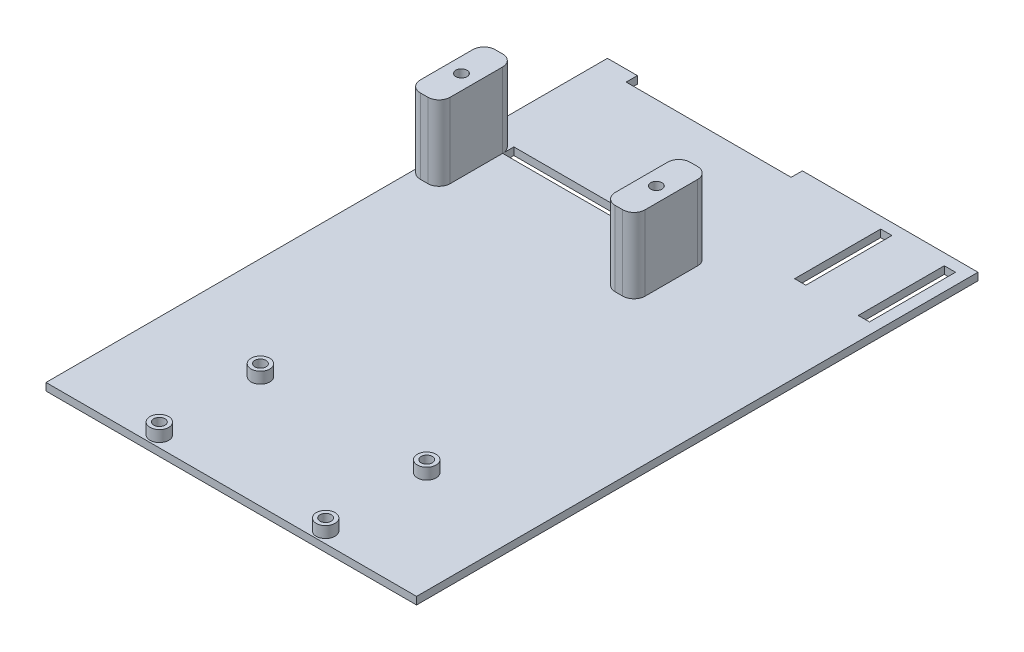
from build123d import *

# Parameters (mm, degrees)
SKETCH1_W           = 99
SKETCH1_H           = 150
BOSS_EXTRUDE1_DEPTH = 2
SKETCH2_W           = 8
SKETCH2_H           = 20
BOSS_EXTRUDE2_DEPTH = 20
SKETCH3_R           = 1.5
CUT_EXTRUDE2_DEPTH  = 15
SKETCH4_R           = 2.5
SKETCH4_R_2         = 1.5
BOSS_EXTRUDE4_DEPTH = 3
SKETCH6_W           = 44.075
SKETCH6_H           = 3
SKETCH6_W_2         = 3
SKETCH6_H_2         = 23
CUT_EXTRUDE3_DEPTH  = 4
FILLET2_R           = 3
FILLET4_R           = 3
FILLET5_R           = 3
FILLET6_R           = 3
FILLET7_R           = 3
FILLET8_R           = 3
FILLET9_R           = 3
FILLET10_R          = 3


with BuildPart() as part:
    # Sketch1 → Boss-Extrude1 (new body)
    with BuildSketch(Plane(origin=(0, 0, 0), x_dir=(1, 0, 0), z_dir=(0, 1, 0))):
        with Locations((49.5, 75)):
            Rectangle(SKETCH1_W, SKETCH1_H)
    extrude(amount=BOSS_EXTRUDE1_DEPTH)

    # Sketch2 → Boss-Extrude2 (add)
    with BuildSketch(Plane(origin=(0, 2, 0), x_dir=(1, 0, 0), z_dir=(0, 1, 0))):
        with Locations((4, 107)):
            Rectangle(SKETCH2_W, SKETCH2_H)
        with Locations((56.075, 107)):
            Rectangle(SKETCH2_W, SKETCH2_H)
    extrude(amount=BOSS_EXTRUDE2_DEPTH)

    # Sketch3 → Cut-Extrude2 (cut)
    with BuildSketch(Plane(origin=(0, 22, 0), x_dir=(1, 0, 0), z_dir=(0, 1, 0))):
        with Locations((4, 107)):
            Circle(SKETCH3_R)
        with Locations((56.075, 107)):
            Circle(SKETCH3_R)
    extrude(amount=-CUT_EXTRUDE2_DEPTH, mode=Mode.SUBTRACT)

    # Sketch4 → Boss-Extrude4 (add)
    # profile 1 of 4: a face of its own
    with BuildSketch(Plane(origin=(0, 2, 0), x_dir=(1, 0, 0), z_dir=(0, 1, 0))):
        with Locations((27.29, 30)):
            Circle(SKETCH4_R)
        with Locations((27.29, 30)):
            Circle(SKETCH4_R_2, mode=Mode.SUBTRACT)
    # profile 2 of 4: a face of its own
    with BuildSketch(Plane(origin=(0, 2, 0), x_dir=(1, 0, 0), z_dir=(0, 1, 0))):
        with Locations((71.71, 30)):
            Circle(SKETCH4_R)
        with Locations((71.71, 30)):
            Circle(SKETCH4_R_2, mode=Mode.SUBTRACT)
    # profile 3 of 4: a face of its own
    with BuildSketch(Plane(origin=(0, 2, 0), x_dir=(1, 0, 0), z_dir=(0, 1, 0))):
        with Locations((71.71, 3)):
            Circle(SKETCH4_R)
        with Locations((71.71, 3)):
            Circle(SKETCH4_R_2, mode=Mode.SUBTRACT)
    # profile 4 of 4: a face of its own
    with BuildSketch(Plane(origin=(0, 2, 0), x_dir=(1, 0, 0), z_dir=(0, 1, 0))):
        with Locations((27.29, 3)):
            Circle(SKETCH4_R)
        with Locations((27.29, 3)):
            Circle(SKETCH4_R_2, mode=Mode.SUBTRACT)
    extrude(amount=BOSS_EXTRUDE4_DEPTH)

    # Sketch6 → Cut-Extrude3 (cut)
    with BuildSketch(Plane(origin=(0, 2, 0), x_dir=(1, 0, 0), z_dir=(0, 1, 0))):
        with Locations((30.0375, 115.5)):
            Rectangle(SKETCH6_W, SKETCH6_H)
        with Locations((30.0375, 148.5)):
            Rectangle(SKETCH6_W, SKETCH6_H)
        with Locations((94.5, 135.5)):
            Rectangle(SKETCH6_W_2, SKETCH6_H_2)
        with Locations((77.5, 135.5)):
            Rectangle(SKETCH6_W_2, SKETCH6_H_2)
    extrude(amount=-CUT_EXTRUDE3_DEPTH, mode=Mode.SUBTRACT)

    # Fillet2
    fillet2_edges = [part.edges().sort_by_distance(p)[0] for p in [
        (8, 12, -97),
    ]]
    fillet(fillet2_edges, radius=FILLET2_R)

    # Fillet4
    fillet4_edges = [part.edges().sort_by_distance(p)[0] for p in [
        (0, 12, -97),
    ]]
    fillet(fillet4_edges, radius=FILLET4_R)

    # Fillet5
    fillet5_edges = [part.edges().sort_by_distance(p)[0] for p in [
        (0, 12, -117),
    ]]
    fillet(fillet5_edges, radius=FILLET5_R)

    # Fillet6
    fillet6_edges = [part.edges().sort_by_distance(p)[0] for p in [
        (8, 12, -117),
    ]]
    fillet(fillet6_edges, radius=FILLET6_R)

    # Fillet7
    fillet7_edges = [part.edges().sort_by_distance(p)[0] for p in [
        (60.075, 12, -97),
    ]]
    fillet(fillet7_edges, radius=FILLET7_R)

    # Fillet8
    fillet8_edges = [part.edges().sort_by_distance(p)[0] for p in [
        (52.075, 12, -97),
    ]]
    fillet(fillet8_edges, radius=FILLET8_R)

    # Fillet9
    fillet9_edges = [part.edges().sort_by_distance(p)[0] for p in [
        (60.075, 12, -117),
    ]]
    fillet(fillet9_edges, radius=FILLET9_R)

    # Fillet10
    fillet10_edges = [part.edges().sort_by_distance(p)[0] for p in [
        (52.075, 12, -117),
    ]]
    fillet(fillet10_edges, radius=FILLET10_R)


solid = part.part
